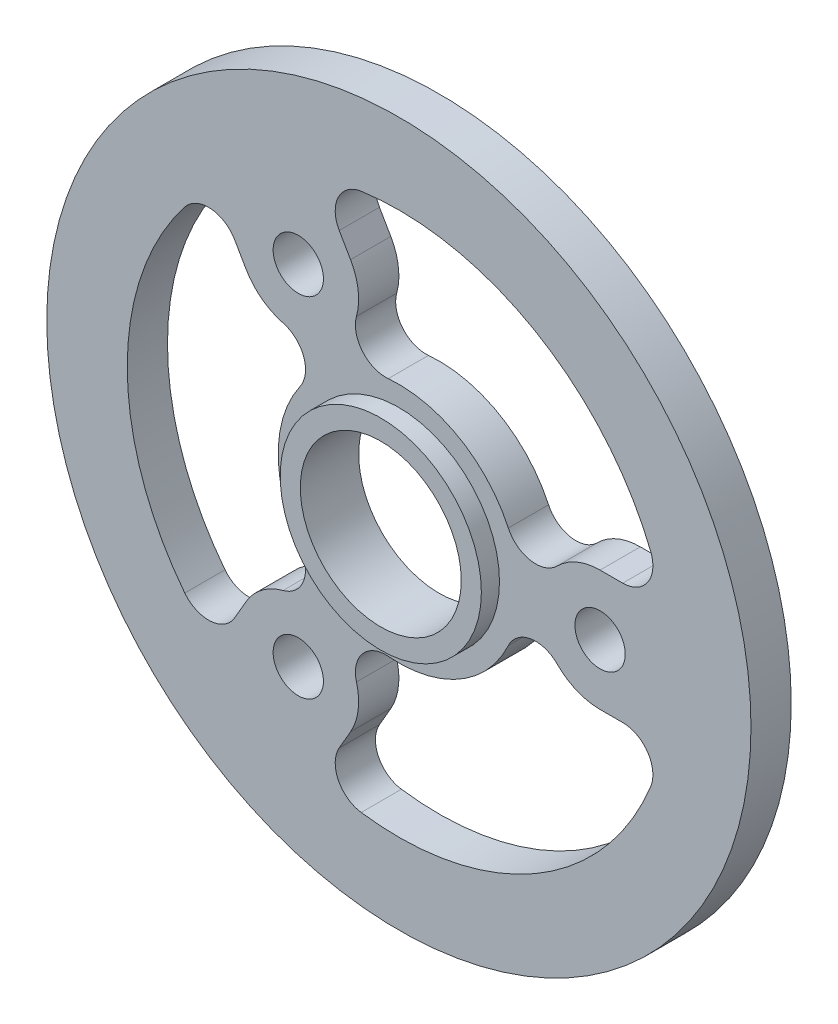
from build123d import *

# Parameters (mm, degrees)
HOLE_WIZARD_M3_1_D  = 2.5
CUT_EXTRUDE_1_DEPTH = 25.829418036
FILLET_1_R          = 1.5


with BuildPart() as part:
    # ｽｹｯﾁ1 → 回転1 (revolve)
    with BuildSketch(Plane(origin=(0, 0, 0), x_dir=(0, 0, -1), z_dir=(1, 0, 0))):
        Polygon((0, 4), (2.9, 4), (2.9, 17.5), (0.9, 17.5), (0.9, 5), (0, 5), align=None)
    revolve(axis=Axis((0, 0, 0), (0, 0, -1)))

    # M3 ねじ穴1 (through all)
    with Locations(Plane.XY.offset(-0.9)):
        with Locations((10, 0), (-5, 8.660254038), (-5, -8.660254038)):
            Hole(HOLE_WIZARD_M3_1_D / 2)

    # ｽｹｯﾁ4 → ｶｯﾄ - 押し出し1 (cut, through all)
    with BuildSketch(Plane.XY.offset(-0.9)):
        with BuildLine():
            ThreePointArc((7.866666667, 2.109238936), (8.844084088, 2.768367462), (10, 3))
            Line((10, 3), (13.162446581, 3))
            ThreePointArc((13.162446581, 3), (6.75, 11.691342951), (-3.983147079, 12.899013115))
            Line((-3.983147079, 12.899013115), (-2.401923789, 10.160254038))
            ThreePointArc((-2.401923789, 10.160254038), (-2.024565495, 9.043385224), (-2.106678832, 7.867352644))
            ThreePointArc((-2.106678832, 7.867352644), (-1.811409663, 6.509497865), (-0.528014599, 5.976721558))
            ThreePointArc((-0.528014599, 5.976721558), (3, 5.196152423), (5.44, 2.531086723))
            ThreePointArc((5.44, 2.531086723), (6.543095348, 1.686022148), (7.866666667, 2.109238936))
        make_face()
        with BuildLine():
            ThreePointArc((10, -3), (8.844084088, -2.768367462), (7.866666667, -2.109238936))
            ThreePointArc((7.866666667, -2.109238936), (6.543095348, -1.686022148), (5.44, -2.531086723))
            ThreePointArc((5.44, -2.531086723), (3, -5.196152423), (-0.528014599, -5.976721558))
            ThreePointArc((-0.528014599, -5.976721558), (-1.811409663, -6.509497865), (-2.106678832, -7.867352644))
            ThreePointArc((-2.106678832, -7.867352644), (-2.024565495, -9.043385224), (-2.401923789, -10.160254038))
            Line((-2.401923789, -10.160254038), (-3.983147079, -12.899013115))
            ThreePointArc((-3.983147079, -12.899013115), (6.75, -11.691342951), (13.162446581, -3))
            Line((13.162446581, -3), (10, -3))
        make_face()
        with BuildLine():
            Line((-7.598076211, 7.160254038), (-9.179299502, 9.899013115))
            ThreePointArc((-9.179299502, 9.899013115), (-13.5, 0), (-9.179299502, -9.899013115))
            Line((-9.179299502, -9.899013115), (-7.598076211, -7.160254038))
            ThreePointArc((-7.598076211, -7.160254038), (-6.819518593, -6.275017762), (-5.759987835, -5.758113708))
            ThreePointArc((-5.759987835, -5.758113708), (-4.731685686, -4.823475717), (-4.911985401, -3.445634835))
            ThreePointArc((-4.911985401, -3.445634835), (-6, 0), (-4.911985401, 3.445634835))
            ThreePointArc((-4.911985401, 3.445634835), (-4.731685686, 4.823475717), (-5.759987835, 5.758113708))
            ThreePointArc((-5.759987835, 5.758113708), (-6.819518593, 6.275017762), (-7.598076211, 7.160254038))
        make_face()
    extrude(amount=-CUT_EXTRUDE_1_DEPTH, mode=Mode.SUBTRACT)

    # ﾌｨﾚｯﾄ1
    fillet_1_edges = [part.edges().sort_by_distance(p)[0] for p in [
        (13.162446581, 3, -1.9),
        (-9.179299502, -9.899013115, -1.9),
        (13.162446581, -3, -1.9),
        (-3.983147079, -12.899013115, -1.9),
        (-9.179299502, 9.899013115, -1.9),
        (-3.983147079, 12.899013115, -1.9),
    ]]
    fillet(fillet_1_edges, radius=FILLET_1_R)


solid = part.part
